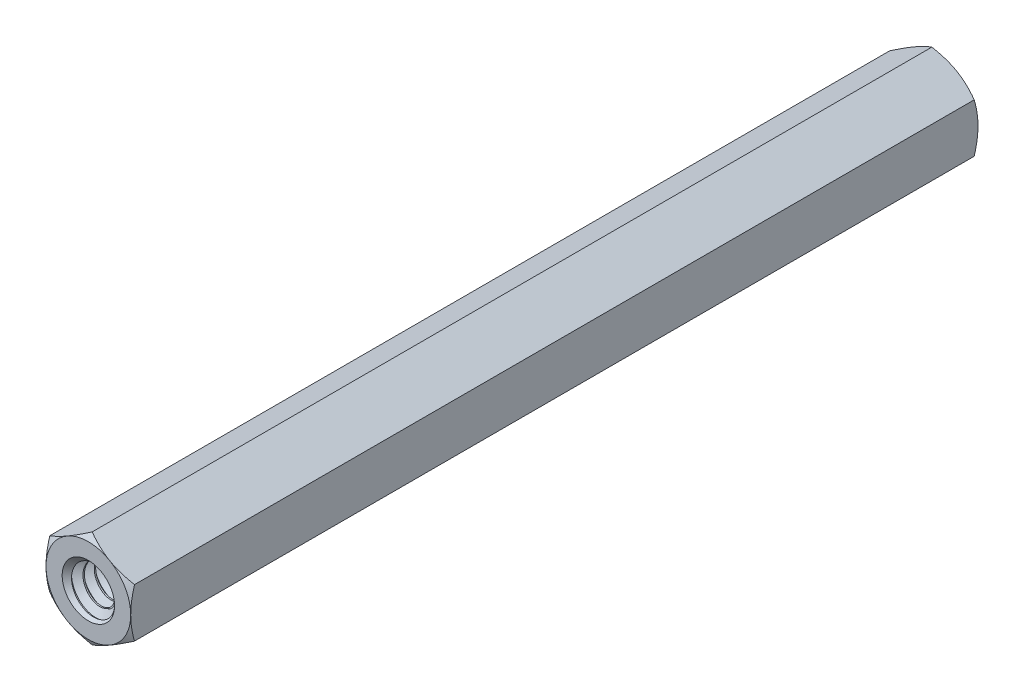
from build123d import *

# Parameters (mm, degrees)
EXTRUDE1_DEPTH          = 23.8125
EXTRUDE1_DEPTH_BACK     = 23.8125
SKETCH1_R               = 1.4224
SWEEP1_PITCH            = 0.635
EXTRUDE2_DEPTH          = 49.397057233
SKETCH8_OUTSIDE_W       = 187.64
SKETCH8_OUTSIDE_H       = 188.378
SKETCH8_OUTSIDE_R       = 2.38125
EXTRUDE4_DEPTH          = 49.397057233
EXTRUDE4_DRAFT          = -60
MIRROR1_COPY_1_SKETCH_W = 187.64
MIRROR1_COPY_1_SKETCH_H = 188.378
MIRROR1_COPY_1_SKETCH_R = 2.38125
MIRROR1_COPY_1_DEPTH    = 49.397057233
MIRROR1_COPY_1_DRAFT    = -60
SKETCH9_W               = 34.925
SKETCH9_H               = 1.4732


with BuildPart() as part:
    # Sketch1 → Extrude1 (new, two sides: drawn at the far end of the back side and taken through both)
    with BuildSketch(Plane.XY.offset(-EXTRUDE1_DEPTH_BACK)):
        Polygon((0, 2.749630657), (-2.38125, 1.374815329), (-2.38125, -1.374815329), (0, -2.749630657), (2.38125, -1.374815329), (2.38125, 1.374815329), align=None)
        Circle(SKETCH1_R, mode=Mode.SUBTRACT)
    extrude(amount=EXTRUDE1_DEPTH + EXTRUDE1_DEPTH_BACK)

    # Sweep1: arcs per turn and ends read off the stored shape
    # Sweep1: the profile of Sketch12 profile screwed along a right-hand helix through 76 turns, 6 arcs to a turn; built about Z, then put on its axis
    sweep1_z = Axis((0, 0, 0), (0, 0, 1))
    sweep1_corners = [(1.4227, 0, -0.555798205), (1.4227, 0, 0.000173205), (1.009955401, 0, -0.238125), (1.009955401, 0, -0.3175)]
    with BuildLine(mode=Mode.PRIVATE) as sweep1_profile:
        Line(sweep1_corners[0], sweep1_corners[1])
        Line(sweep1_corners[1], sweep1_corners[2])
        Line(sweep1_corners[2], sweep1_corners[3])
        Line(sweep1_corners[3], sweep1_corners[0])
    sweep1_cap = Face(sweep1_profile.wire())
    sweep1_turn_angles = [0, 30, 60, 90, 120, 150, 180, 210, 240, 270, 300, 330, 360]
    sweep1_turn_weights = [1, 0.8660254037844387, 1, 0.8660254037844387, 1, 0.8660254037844387, 1, 0.8660254037844387, 1, 0.8660254037844387, 1, 0.8660254037844387, 1]
    sweep1_turn_rails = [Edge.make_bspline([Vector(p[0], p[1], 0).rotate(sweep1_z, sweep1_turn_angles[k]) / sweep1_turn_weights[k] + Vector(0, 0, p[2] + SWEEP1_PITCH * sweep1_turn_angles[k] / 360) for k in range(13)], [0, 0, 0, 1, 1, 2, 2, 3, 3, 4, 4, 5, 5, 6, 6, 6], 2, sweep1_turn_weights) for p in sweep1_corners]
    sweep1_turn_sides = [Face.make_surface_from_curves(sweep1_turn_rails[p[0]], sweep1_turn_rails[p[1]]) for p in [(0, 1), (1, 2), (2, 3), (3, 0)]]
    sweep1 = Plane(origin=(0, 0, -23.8125), x_dir=(0, 1, 0), z_dir=(0, 0, 1)) * Solid(Shell([*[p.moved(Location((0, 0, SWEEP1_PITCH * i))) for i in range(76) for p in sweep1_turn_sides], sweep1_cap, sweep1_cap.rotate(sweep1_z, 27360).moved(Location((0, 0, SWEEP1_PITCH * 27360 / 360)))]))
    add(sweep1)

    # Sketch6 → Extrude2 (cut, through all)
    with BuildSketch(Plane(origin=(0, 0, -23.8125), x_dir=(-1, 0, 0), z_dir=(0, 0, -1))):
        Polygon((0, 2.749630657), (-2.38125, 1.374815329), (-2.38125, -1.374815329), (0, -2.749630657), (2.38125, -1.374815329), (2.38125, 1.374815329), align=None)
    extrude2 = extrude(amount=EXTRUDE2_DEPTH, mode=Mode.SUBTRACT)

    # Extrude3 cone 1 section (through the dimple's axis) → Extrude3 (revolve, cut)
    with BuildSketch(Plane(origin=(0, 0, -23.8125), x_dir=(0, 1, 0), z_dir=(1, 0, 0))):
        Polygon((0, 0), (1.4732, 0), (0, 1.579813584), align=None)
    extrude3 = revolve(axis=Axis((0, 0, -23.8125), (0, 0, 1)), mode=Mode.SUBTRACT)


with BuildPart() as extrude4_tool:
    # Sketch8 outside → Extrude4 (with draft: the straight prism first)
    with BuildSketch(Plane(origin=(0, 0, -23.8125), x_dir=(-1, 0, 0), z_dir=(0, 0, -1))):
        Rectangle(SKETCH8_OUTSIDE_W, SKETCH8_OUTSIDE_H)
        Circle(SKETCH8_OUTSIDE_R, mode=Mode.SUBTRACT)
    extrude(amount=-EXTRUDE4_DEPTH)
    # Extrude4: the draft: its side faces are tilted about the plane it starts from
    extrude4_sides = [extrude4_tool.faces().sort_by_distance(p)[0] for p in [
        (0, -94.189, 0.886028616),
        (-93.82, 0, 0.886028616),
        (0, 94.189, 0.886028616),
        (93.82, 0, 0.886028616),
        (2.38125, 0, 0.886028616),
    ]]
    draft(extrude4_sides, Plane(origin=(0, 0, -23.8125), x_dir=(-1, 0, 0), z_dir=(0, 0, -1)), EXTRUDE4_DRAFT)


with BuildPart() as part_1:
    add(part.part)

    # Extrude4: cut by extrude4_tool
    add(extrude4_tool.part, mode=Mode.SUBTRACT)

    # Mirror1: Extrude2, Extrude3 across plane
    add(extrude2.mirror(Plane.XY), mode=Mode.SUBTRACT)
    add(extrude3.mirror(Plane.XY), mode=Mode.SUBTRACT)


with BuildPart() as mirror1_copy_1_tool:
    # Mirror1 copy 1 sketch → Mirror1 copy 1 (with draft: the straight prism first)
    with BuildSketch(Plane(origin=(0, 0, 23.8125), x_dir=(-1, 0, 0), z_dir=(0, 0, 1))):
        Rectangle(MIRROR1_COPY_1_SKETCH_W, MIRROR1_COPY_1_SKETCH_H)
        Circle(MIRROR1_COPY_1_SKETCH_R, mode=Mode.SUBTRACT)
    extrude(amount=-MIRROR1_COPY_1_DEPTH)
    # Mirror1 copy 1: the draft: its side faces are tilted about the plane it starts from
    mirror1_copy_1_sides = [mirror1_copy_1_tool.faces().sort_by_distance(p)[0] for p in [
        (0, -94.189, -0.886028616),
        (-93.82, 0, -0.886028616),
        (0, 94.189, -0.886028616),
        (93.82, 0, -0.886028616),
        (2.38125, 0, -0.886028616),
    ]]
    draft(mirror1_copy_1_sides, Plane(origin=(0, 0, 23.8125), x_dir=(-1, 0, 0), z_dir=(0, 0, 1)), MIRROR1_COPY_1_DRAFT)


with BuildPart() as part_2:
    add(part_1.part)

    # Mirror1 copy 1: cut by mirror1_copy_1_tool
    add(mirror1_copy_1_tool.part, mode=Mode.SUBTRACT)

    # Sketch9 → Revolve 2 (revolve)
    with BuildSketch(Plane(origin=(0, 0, 0), x_dir=(0, 0, -1), z_dir=(1, 0, 0)), mode=Mode.PRIVATE) as revolve_2_sk:
        with Locations((0, 0.7366)):
            Rectangle(SKETCH9_W, SKETCH9_H)
    revolve(revolve_2_sk.sketch.rotate(Axis((0, 0, 23.8125), (0, 0, -1)), 270), axis=Axis((0, 0, 23.8125), (0, 0, -1)))


solid = part_2.part
